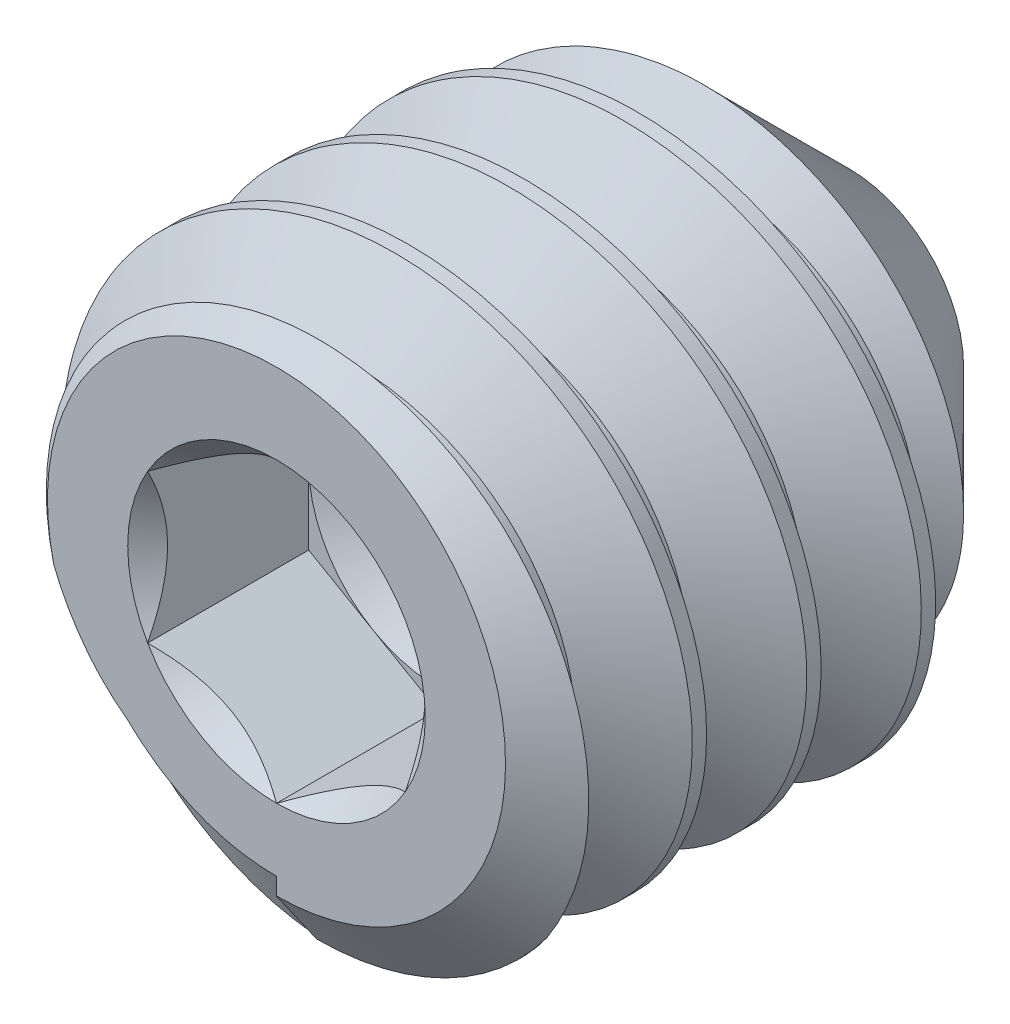
from build123d import *

# Parameters (mm, degrees)
CUT_EXTRUDE1_DEPTH = 0.5625
CUT_SWEEP1_PITCH   = 0.4


with BuildPart() as part:
    # Sketch1 → Revolve1 (revolve)
    with BuildSketch(Plane(origin=(0, 0, 0), x_dir=(0, 0, -1), z_dir=(1, 0, 0)), mode=Mode.PRIVATE) as revolve1_sk:
        Polygon((-0.879827876, 0), (-0.879827876, 0.8), (-0.739786369, 1), (0.520172124, 1), (1.120172124, 0.4), (0.879827876, 0), align=None)
    revolve(revolve1_sk.sketch.rotate(Axis((0, 0, -0.879827876), (0, 0, -1)), 180), axis=Axis((0, 0, -0.879827876), (0, 0, -1)))

    # Sketch2 → Cut-Extrude1 (cut)
    with BuildSketch(Plane.XY.offset(0.879827876)):
        Polygon((0, 0.519615242), (-0.45, 0.259807621), (-0.45, -0.259807621), (0, -0.519615242), (0.45, -0.259807621), (0.45, 0.259807621), align=None)
    extrude(amount=-CUT_EXTRUDE1_DEPTH, mode=Mode.SUBTRACT)

    # Cut-Extrude2 cone 1 section (through the dimple's axis) → Cut-Extrude2 (revolve, cut)
    with BuildSketch(Plane(origin=(0, 0, 0.879827876), x_dir=(0, -1, 0), z_dir=(1, 0, 0))):
        Polygon((0, 0), (0.519615242, 0), (0, 0.519615242), align=None)
    revolve(axis=Axis((0, 0, 0.879827876), (0, 0, -1)), mode=Mode.SUBTRACT)

    # Cut-Extrude3 cone 1 section (through the dimple's axis) → Cut-Extrude3 (revolve, cut)
    with BuildSketch(Plane(origin=(0, 0, 0.317327876), x_dir=(0, -1, 0), z_dir=(1, 0, 0))):
        Polygon((0, 0), (0.45, 0), (0, 0.259807621), align=None)
    revolve(axis=Axis((0, 0, 0.317327876), (0, 0, -1)), mode=Mode.SUBTRACT)

    # Cut-Sweep1: the profile of Sketch6 screwed along a right-hand helix of 5.5 turns, 6 arcs to a turn; built about Z, then put on its axis
    cut_sweep1_z = Axis((0, 0, 0), (0, 0, 1))
    cut_sweep1_corners = [(0.740192379, 0, -0.15), (1.021650635, 0, 0.0125), (1.021650635, 0, -0.3625), (0.740192379, 0, -0.2)]
    with BuildLine(mode=Mode.PRIVATE) as cut_sweep1_profile:
        Line(cut_sweep1_corners[0], cut_sweep1_corners[1])
        Line(cut_sweep1_corners[1], cut_sweep1_corners[2])
        Line(cut_sweep1_corners[2], cut_sweep1_corners[3])
        Line(cut_sweep1_corners[3], cut_sweep1_corners[0])
    cut_sweep1_cap = Face(cut_sweep1_profile.wire())
    cut_sweep1_turn_angles = [0, 30, 60, 90, 120, 150, 180, 210, 240, 270, 300, 330, 360]
    cut_sweep1_turn_weights = [1, 0.8660254037844387, 1, 0.8660254037844387, 1, 0.8660254037844387, 1, 0.8660254037844387, 1, 0.8660254037844387, 1, 0.8660254037844387, 1]
    cut_sweep1_turn_rails = [Edge.make_bspline([Vector(p[0], p[1], 0).rotate(cut_sweep1_z, cut_sweep1_turn_angles[k]) / cut_sweep1_turn_weights[k] + Vector(0, 0, p[2] + CUT_SWEEP1_PITCH * cut_sweep1_turn_angles[k] / 360) for k in range(13)], [0, 0, 0, 1, 1, 2, 2, 3, 3, 4, 4, 5, 5, 6, 6, 6], 2, cut_sweep1_turn_weights) for p in cut_sweep1_corners]
    cut_sweep1_turn_sides = [Face.make_surface_from_curves(cut_sweep1_turn_rails[p[0]], cut_sweep1_turn_rails[p[1]]) for p in [(0, 1), (1, 2), (2, 3), (3, 0)]]
    cut_sweep1_last_angles = [1800, 1830, 1860, 1890, 1920, 1950, 1980]
    cut_sweep1_last_weights = [1, 0.8660254037844387, 1, 0.8660254037844387, 1, 0.8660254037844198, 1]
    cut_sweep1_last_rails = [Edge.make_bspline([Vector(p[0], p[1], 0).rotate(cut_sweep1_z, cut_sweep1_last_angles[k]) / cut_sweep1_last_weights[k] + Vector(0, 0, p[2] + CUT_SWEEP1_PITCH * cut_sweep1_last_angles[k] / 360) for k in range(7)], [0, 0, 0, 1, 1, 2, 2, 3, 3, 3], 2, cut_sweep1_last_weights) for p in cut_sweep1_corners]
    cut_sweep1_last_sides = [Face.make_surface_from_curves(cut_sweep1_last_rails[p[0]], cut_sweep1_last_rails[p[1]]) for p in [(0, 1), (1, 2), (2, 3), (3, 0)]]
    cut_sweep1 = Plane(origin=(0, 0, -1.120172124), x_dir=(0, 1, 0), z_dir=(0, 0, 1)) * Solid(Shell([*[p.moved(Location((0, 0, CUT_SWEEP1_PITCH * i))) for i in range(5) for p in cut_sweep1_turn_sides], *cut_sweep1_last_sides, cut_sweep1_cap, cut_sweep1_cap.rotate(cut_sweep1_z, 1980).moved(Location((0, 0, CUT_SWEEP1_PITCH * 1980 / 360)))]))
    add(cut_sweep1, mode=Mode.SUBTRACT)


solid = part.part
